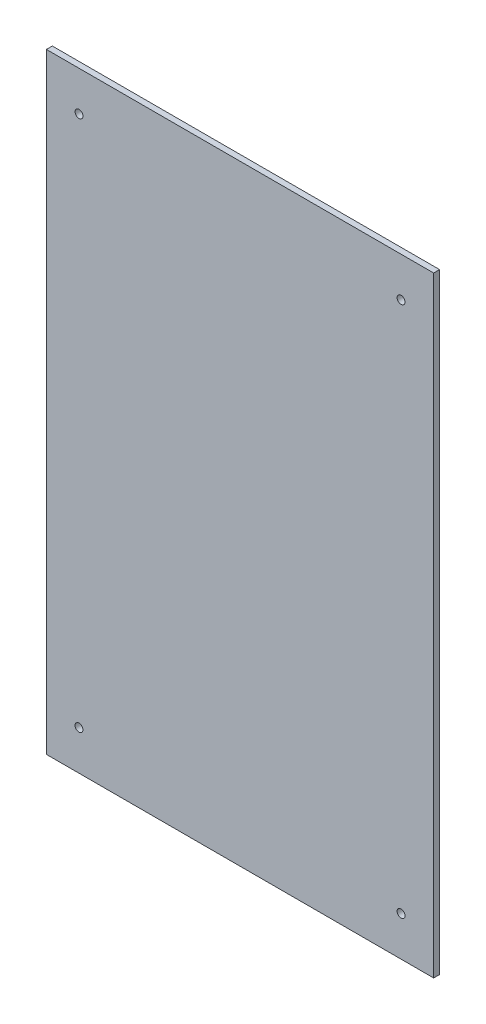
from build123d import *

# Parameters (mm, degrees)
ESQUISSE1_W        = 196
ESQUISSE1_H        = 309
ESQUISSE1_R        = 2
BOSS_EXTRU_1_DEPTH = 3


with BuildPart() as part:
    # Esquisse1 → Boss.-Extru.1 (new body)
    with BuildSketch(Plane.XY):
        Rectangle(ESQUISSE1_W, ESQUISSE1_H)
        with Locations((-81.5, 134.5)):
            Circle(ESQUISSE1_R, mode=Mode.SUBTRACT)
        with Locations((81.5, 134.5)):
            Circle(ESQUISSE1_R, mode=Mode.SUBTRACT)
        with Locations((81.5, -134.5)):
            Circle(ESQUISSE1_R, mode=Mode.SUBTRACT)
        with Locations((-81.5, -134.5)):
            Circle(ESQUISSE1_R, mode=Mode.SUBTRACT)
    extrude(amount=BOSS_EXTRU_1_DEPTH)


solid = part.part
